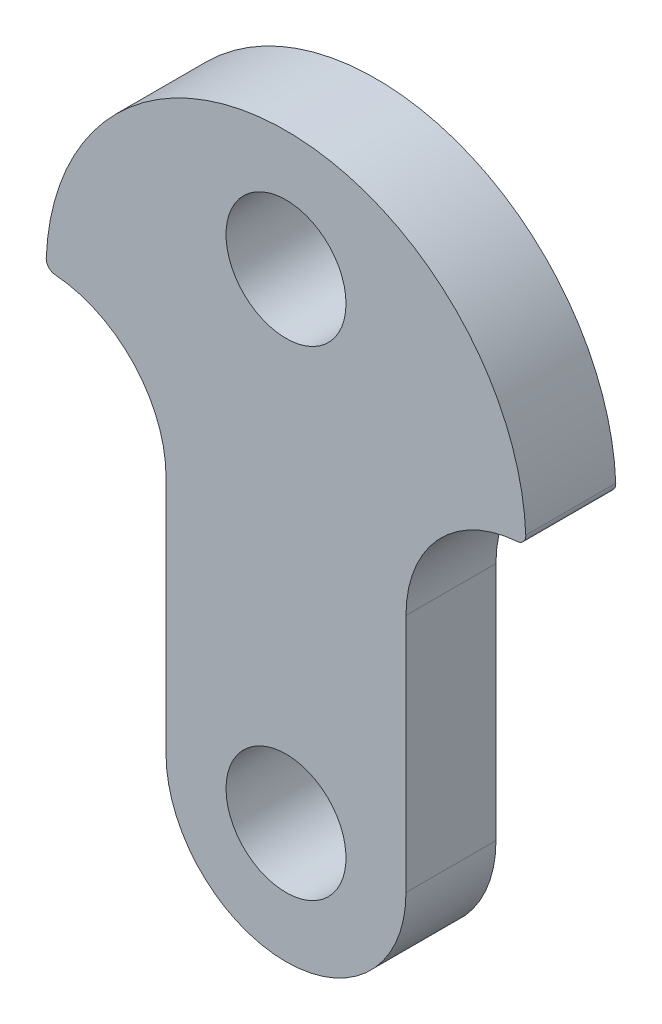
from build123d import *

# Parameters (mm, degrees)
SKETCH1_R           = 6.35
BOSS_EXTRUDE1_DEPTH = 9.525
SKETCH2_R           = 6.35
CUT_EXTRUDE1_DEPTH  = 73.470722537
FILLET1_R           = 12.7
FILLET2_R           = 1


with BuildPart() as part:
    # Sketch1 → Boss-Extrude1 (new body)
    with BuildSketch(Plane.XY):
        with BuildLine():
            Line((0, 0), (12.7, 0))
            Line((12.7, 0), (12.7, -38.1))
            ThreePointArc((12.7, -38.1), (25.4, -50.8), (38.1, -38.1))
            Line((38.1, -38.1), (38.1, 0))
            Line((38.1, 0), (50.8, 0))
            ThreePointArc((50.8, 0), (25.4, 25.4), (0, 0))
        make_face()
        with Locations(Location((25.4, -38.1, 0), (0, 0, 180))):
            Circle(SKETCH1_R, mode=Mode.SUBTRACT)
    extrude(amount=BOSS_EXTRUDE1_DEPTH)

    # Sketch2 → Cut-Extrude1 (cut, through all)
    with BuildSketch(Plane.XY.offset(9.525)):
        with Locations((25.4, 12.7)):
            Circle(SKETCH2_R)
    extrude(amount=-CUT_EXTRUDE1_DEPTH, mode=Mode.SUBTRACT)

    # Fillet1
    fillet1_edges = [part.edges().sort_by_distance(p)[0] for p in [
        (38.1, 0, 4.7625),
        (12.7, 0, 4.7625),
    ]]
    fillet(fillet1_edges, radius=FILLET1_R - 0.0001)  # a hair under: the kernel refuses the full size

    # Fillet2
    fillet2_edges = [part.edges().sort_by_distance(p)[0] for p in [
        (0, 0, 4.7625),
        (50.8, 0, 4.7625),
    ]]
    fillet(fillet2_edges, radius=FILLET2_R)


solid = part.part
